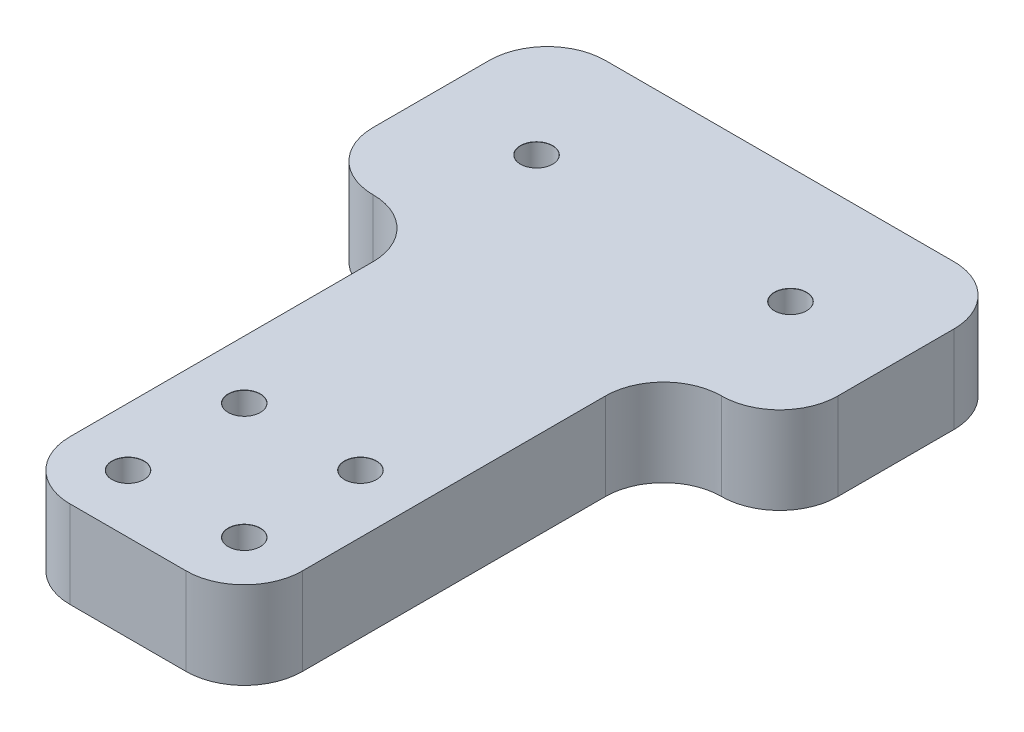
from build123d import *

# Parameters (mm, degrees)
BOSS_EXTRUDE1_DEPTH            = 15
M5_CLEARANCE_HOLE1_D           = 5.5
M5_CLEARANCE_HOLE1_CSINK_D     = 5.55
M5_CLEARANCE_HOLE1_CSINK_ANGLE = 90
FILLET1_START                  = -1
FILLET1_DEPTH                  = 17
FILLET1_2_DEPTH                = 15


with BuildPart() as part:
    # Sketch1 → Boss-Extrude1 (new body)
    with BuildSketch(Plane(origin=(0, 0, 0), x_dir=(1, 0, 0), z_dir=(0, 1, 0))):
        Polygon((0, 0), (40, 0), (40, 72.15), (60, 72.15), (60, 112.15), (-20, 112.15), (-20, 72.15), (0, 72.15), align=None)
    extrude(amount=BOSS_EXTRUDE1_DEPTH)

    # M5 Clearance Hole1 (through all)
    with Locations(Plane(origin=(0, 15, 0), x_dir=(1, 0, 0), z_dir=(0, 1, 0))):
        with Locations((-1.85, 92.15), (41.85, 92.15), (10, 30), (30, 30), (10, 10), (30, 10)):
            CounterSinkHole(M5_CLEARANCE_HOLE1_D / 2, M5_CLEARANCE_HOLE1_CSINK_D / 2, counter_sink_angle=M5_CLEARANCE_HOLE1_CSINK_ANGLE)

    # Fillet1: read off the stored shape, not the designer's step
    # Fillet1 outline → Fillet1 (cut)
    with BuildSketch(Plane(origin=(0, 0, 0), x_dir=(1, 0, 0), z_dir=(0, 1, 0)).offset(FILLET1_START)):
        with BuildLine():
            Line((0, 0), (10, 0))
            add(Edge.make_bspline(
                [(10, 0), (0, 0), (0, 10)],
                knots=[0, 0, 0, 1, 1, 1], degree=2, weights=[1, 0.707106781, 1]))
            Line((0, 10), (0, 0))
        make_face()
        with BuildLine():
            add(Edge.make_bspline(
                [(40, 10), (40, 0), (30, 0)],
                knots=[0, 0, 0, 1, 1, 1], degree=2, weights=[1, 0.707106781, 1]))
            Line((30, 0), (40, 0))
            Line((40, 0), (40, 10))
        make_face()
        with BuildLine():
            Line((-20, 72.15), (-10, 72.15))
            add(Edge.make_bspline(
                [(-10, 72.15), (-20, 72.15), (-20, 82.15)],
                knots=[0, 0, 0, 1, 1, 1], degree=2, weights=[1, 0.707106781, 1]))
            Line((-20, 82.15), (-20, 72.15))
        make_face()
        with BuildLine():
            add(Edge.make_bspline(
                [(60, 82.15), (60, 72.15), (50, 72.15)],
                knots=[0, 0, 0, 1, 1, 1], degree=2, weights=[1, 0.707106781, 1]))
            Line((50, 72.15), (60, 72.15))
            Line((60, 72.15), (60, 82.15))
        make_face()
        with BuildLine():
            Line((-20, 112.15), (-20, 102.15))
            add(Edge.make_bspline(
                [(-20, 102.15), (-20, 112.15), (-10, 112.15)],
                knots=[0, 0, 0, 1, 1, 1], degree=2, weights=[1, 0.707106781, 1]))
            Line((-10, 112.15), (-20, 112.15))
        make_face()
        with BuildLine():
            add(Edge.make_bspline(
                [(50, 112.15), (60, 112.15), (60, 102.15)],
                knots=[0, 0, 0, 1, 1, 1], degree=2, weights=[1, 0.707106781, 1]))
            Line((60, 102.15), (60, 112.15))
            Line((60, 112.15), (50, 112.15))
        make_face()
    extrude(amount=FILLET1_DEPTH, mode=Mode.SUBTRACT)

    # Fillet1 2 outline → Fillet1 2 (add)
    with BuildSketch(Plane(origin=(0, 0, 0), x_dir=(1, 0, 0), z_dir=(0, 1, 0))):
        with BuildLine():
            add(Edge.make_bspline(
                [(0, 62.15), (0, 72.15), (-10, 72.15)],
                knots=[0, 0, 0, 1, 1, 1], degree=2, weights=[1, 0.707106781, 1]))
            Line((0, 62.15), (0, 72.15))
            Line((0, 72.15), (-10, 72.15))
        make_face()
        with BuildLine():
            Line((40, 72.15), (40, 62.15))
            add(Edge.make_bspline(
                [(50, 72.15), (40, 72.15), (40, 62.15)],
                knots=[0, 0, 0, 1, 1, 1], degree=2, weights=[1, 0.707106781, 1]))
            Line((50, 72.15), (40, 72.15))
        make_face()
    extrude(amount=FILLET1_2_DEPTH)


solid = part.part
